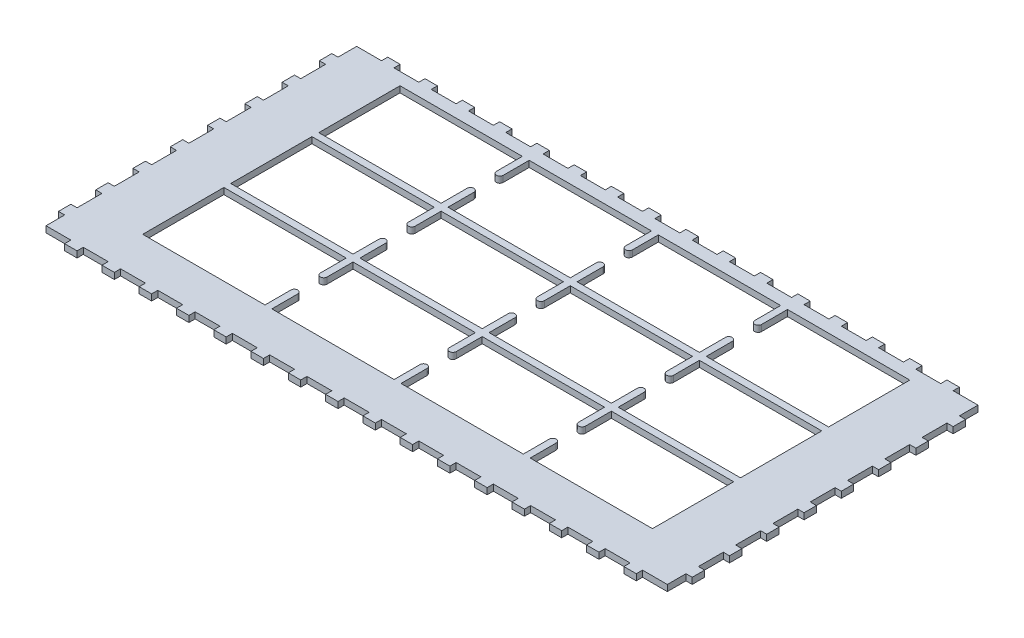
from build123d import *

# Parameters (mm, degrees)
SKETCH7_W            = 635
SKETCH7_H            = 317.5
SKETCH7_W_2          = 125
SKETCH7_H_2          = 83
BOSS_EXTRUDE4_DEPTH  = 6.35
SKETCH8_W            = 12.7
SKETCH8_H            = 6.35
SKETCH8_W_2          = 6.35
SKETCH8_H_2          = 12.7
BOSS_EXTRUDE5_DEPTH  = 6.35
CUT_EXTRUDE2_REACH   = 365.562
LPATTERN1_COUNT      = 3
LPATTERN1_PITCH      = 132
LPATTERN1_COUNT_DIR2 = 3
LPATTERN1_PITCH_DIR2 = 90


with BuildPart() as part:
    # Sketch7 → Boss-Extrude4 (new body)
    with BuildSketch(Plane(origin=(0, 0, 0), x_dir=(1, 0, 0), z_dir=(0, 1, 0))):
        Rectangle(SKETCH7_W, SKETCH7_H)
        with Locations((-66, 104.55)):
            Rectangle(SKETCH7_W_2, SKETCH7_H_2, mode=Mode.SUBTRACT)
        with Locations((-198, 104.55)):
            Rectangle(SKETCH7_W_2, SKETCH7_H_2, mode=Mode.SUBTRACT)
        with Locations((66, 104.55)):
            Rectangle(SKETCH7_W_2, SKETCH7_H_2, mode=Mode.SUBTRACT)
        with Locations((-198, -75.45)):
            Rectangle(SKETCH7_W_2, SKETCH7_H_2, mode=Mode.SUBTRACT)
        with Locations((-66, -75.45)):
            Rectangle(SKETCH7_W_2, SKETCH7_H_2, mode=Mode.SUBTRACT)
        with Locations((66, -75.45)):
            Rectangle(SKETCH7_W_2, SKETCH7_H_2, mode=Mode.SUBTRACT)
        with Locations((-66, 14.55)):
            Rectangle(SKETCH7_W_2, SKETCH7_H_2, mode=Mode.SUBTRACT)
        with Locations((66, 14.55)):
            Rectangle(SKETCH7_W_2, SKETCH7_H_2, mode=Mode.SUBTRACT)
        with Locations((198, 104.55)):
            Rectangle(SKETCH7_W_2, SKETCH7_H_2, mode=Mode.SUBTRACT)
        with Locations((198, 14.55)):
            Rectangle(SKETCH7_W_2, SKETCH7_H_2, mode=Mode.SUBTRACT)
        with Locations((198, -75.45)):
            Rectangle(SKETCH7_W_2, SKETCH7_H_2, mode=Mode.SUBTRACT)
        with Locations((-198, 14.55)):
            Rectangle(SKETCH7_W_2, SKETCH7_H_2, mode=Mode.SUBTRACT)
    extrude(amount=BOSS_EXTRUDE4_DEPTH)

    # Sketch8 → Boss-Extrude5 (add)
    with BuildSketch(Plane(origin=(0, 0, 0), x_dir=(1, 0, 0), z_dir=(0, 1, 0))):
        with Locations((-285.75, 161.925)):
            Rectangle(SKETCH8_W, SKETCH8_H)
        with Locations((19.05, 161.925)):
            Rectangle(SKETCH8_W, SKETCH8_H)
        with Locations((-320.675, 133.35)):
            Rectangle(SKETCH8_W_2, SKETCH8_H_2)
        with Locations((-320.675, 95.25)):
            Rectangle(SKETCH8_W_2, SKETCH8_H_2)
        with Locations((-320.675, 57.15)):
            Rectangle(SKETCH8_W_2, SKETCH8_H_2)
        with Locations((-320.675, 19.05)):
            Rectangle(SKETCH8_W_2, SKETCH8_H_2)
        with Locations((-320.675, -19.05)):
            Rectangle(SKETCH8_W_2, SKETCH8_H_2)
        with Locations((-320.675, -57.15)):
            Rectangle(SKETCH8_W_2, SKETCH8_H_2)
        with Locations((-320.675, -95.25)):
            Rectangle(SKETCH8_W_2, SKETCH8_H_2)
        with Locations((-320.675, -133.35)):
            Rectangle(SKETCH8_W_2, SKETCH8_H_2)
        with Locations((-247.65, 161.925)):
            Rectangle(SKETCH8_W, SKETCH8_H)
        with Locations((-209.55, 161.925)):
            Rectangle(SKETCH8_W, SKETCH8_H)
        with Locations((-171.45, 161.925)):
            Rectangle(SKETCH8_W, SKETCH8_H)
        with Locations((-133.35, 161.925)):
            Rectangle(SKETCH8_W, SKETCH8_H)
        with Locations((-95.25, 161.925)):
            Rectangle(SKETCH8_W, SKETCH8_H)
        with Locations((-57.15, 161.925)):
            Rectangle(SKETCH8_W, SKETCH8_H)
        with Locations((-19.05, 161.925)):
            Rectangle(SKETCH8_W, SKETCH8_H)
        with Locations((57.15, 161.925)):
            Rectangle(SKETCH8_W, SKETCH8_H)
        with Locations((95.25, 161.925)):
            Rectangle(SKETCH8_W, SKETCH8_H)
        with Locations((133.35, 161.925)):
            Rectangle(SKETCH8_W, SKETCH8_H)
        with Locations((171.45, 161.925)):
            Rectangle(SKETCH8_W, SKETCH8_H)
        with Locations((209.55, 161.925)):
            Rectangle(SKETCH8_W, SKETCH8_H)
        with Locations((247.65, 161.925)):
            Rectangle(SKETCH8_W, SKETCH8_H)
        with Locations((285.75, 161.925)):
            Rectangle(SKETCH8_W, SKETCH8_H)
        with Locations((320.675, -133.35)):
            Rectangle(SKETCH8_W_2, SKETCH8_H_2)
        with Locations((320.675, -95.25)):
            Rectangle(SKETCH8_W_2, SKETCH8_H_2)
        with Locations((320.675, -57.15)):
            Rectangle(SKETCH8_W_2, SKETCH8_H_2)
        with Locations((320.675, -19.05)):
            Rectangle(SKETCH8_W_2, SKETCH8_H_2)
        with Locations((320.675, 19.05)):
            Rectangle(SKETCH8_W_2, SKETCH8_H_2)
        with Locations((320.675, 57.15)):
            Rectangle(SKETCH8_W_2, SKETCH8_H_2)
        with Locations((320.675, 95.25)):
            Rectangle(SKETCH8_W_2, SKETCH8_H_2)
        with Locations((320.675, 133.35)):
            Rectangle(SKETCH8_W_2, SKETCH8_H_2)
        with Locations((285.75, -161.925)):
            Rectangle(SKETCH8_W, SKETCH8_H)
        with Locations((247.65, -161.925)):
            Rectangle(SKETCH8_W, SKETCH8_H)
        with Locations((209.55, -161.925)):
            Rectangle(SKETCH8_W, SKETCH8_H)
        with Locations((171.45, -161.925)):
            Rectangle(SKETCH8_W, SKETCH8_H)
        with Locations((133.35, -161.925)):
            Rectangle(SKETCH8_W, SKETCH8_H)
        with Locations((95.25, -161.925)):
            Rectangle(SKETCH8_W, SKETCH8_H)
        with Locations((57.15, -161.925)):
            Rectangle(SKETCH8_W, SKETCH8_H)
        with Locations((19.05, -161.925)):
            Rectangle(SKETCH8_W, SKETCH8_H)
        with Locations((-19.05, -161.925)):
            Rectangle(SKETCH8_W, SKETCH8_H)
        with Locations((-57.15, -161.925)):
            Rectangle(SKETCH8_W, SKETCH8_H)
        with Locations((-95.25, -161.925)):
            Rectangle(SKETCH8_W, SKETCH8_H)
        with Locations((-133.35, -161.925)):
            Rectangle(SKETCH8_W, SKETCH8_H)
        with Locations((-171.45, -161.925)):
            Rectangle(SKETCH8_W, SKETCH8_H)
        with Locations((-209.55, -161.925)):
            Rectangle(SKETCH8_W, SKETCH8_H)
        with Locations((-247.65, -161.925)):
            Rectangle(SKETCH8_W, SKETCH8_H)
        with Locations((-285.75, -161.925)):
            Rectangle(SKETCH8_W, SKETCH8_H)
    extrude(amount=BOSS_EXTRUDE5_DEPTH)

    # Sketch10 → Cut-Extrude2 (cut, up to next)
    with BuildSketch(Plane(origin=(0, 6.35, 0), x_dir=(1, 0, 0), z_dir=(0, 1, 0)), mode=Mode.PRIVATE) as cut_extrude2_sk1:
        with BuildLine():
            ThreePointArc((128.5, -90.45), (132, -86.95), (135.5, -90.45))
            Line((135.5, -90.45), (135.5, -60.45))
            ThreePointArc((135.5, -60.45), (132, -63.95), (128.5, -60.45))
            Line((128.5, -60.45), (128.5, -90.45))
        make_face()
    cut_extrude2_tool1 = extrude(cut_extrude2_sk1.sketch, amount=-CUT_EXTRUDE2_REACH, mode=Mode.PRIVATE) & part.part
    cut_extrude2 = cut_extrude2_tool1.solids().sort_by_distance((132, 6.35, 75.45))[0]
    add(cut_extrude2, mode=Mode.SUBTRACT)

    # LPattern1: Cut-Extrude2 3 × 3
    with Locations(*[(-i * LPATTERN1_PITCH, 0, -j * LPATTERN1_PITCH_DIR2) for i in range(LPATTERN1_COUNT) for j in range(LPATTERN1_COUNT_DIR2) if (i, j) != (0, 0)]):
        add(cut_extrude2, mode=Mode.SUBTRACT)


solid = part.part
